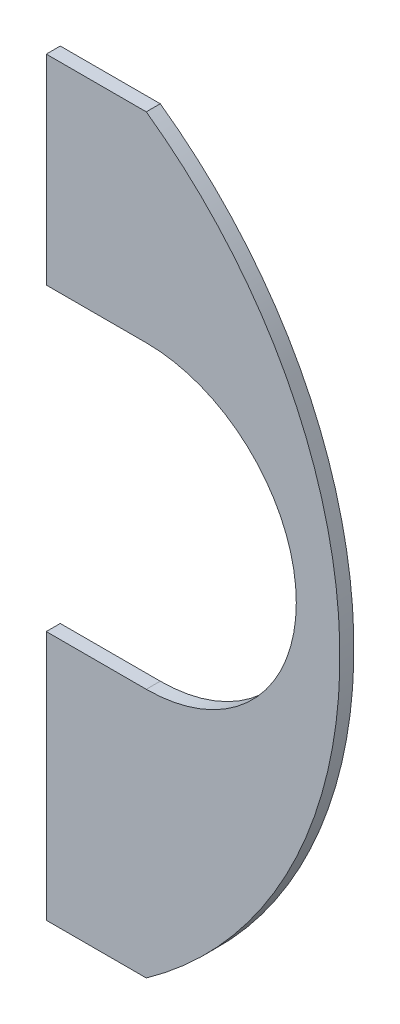
from build123d import *

# Parameters (mm, degrees)
BOSS_EXTRUDE1_DEPTH = 0.7


with BuildPart() as part:
    # Sketch1 → Boss-Extrude1 (new body)
    with BuildSketch(Plane.XY):
        with BuildLine():
            Line((0, 0), (5, 0))
            ThreePointArc((5, 0), (14.679433195, 18.75), (5, 37.5))
            Line((5, 37.5), (0, 37.5))
            Line((0, 37.5), (0, 27.5))
            Line((0, 27.5), (5, 27.5))
            ThreePointArc((5, 27.5), (12.5, 20), (5, 12.5))
            Line((5, 12.5), (0, 12.5))
            Line((0, 12.5), (0, 0))
        make_face()
    extrude(amount=BOSS_EXTRUDE1_DEPTH)


solid = part.part
